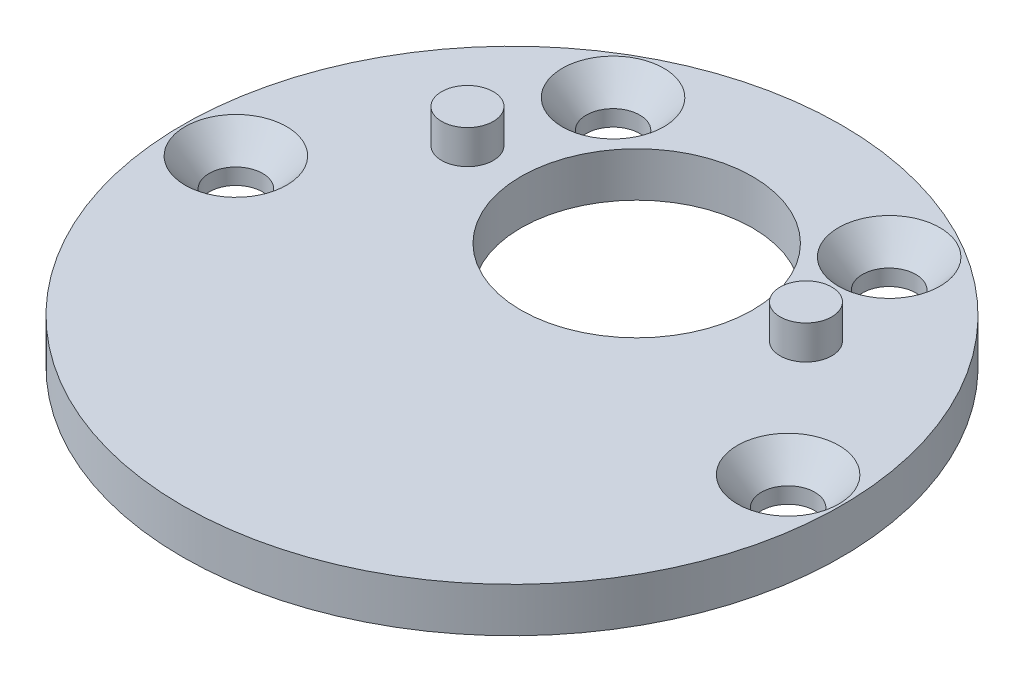
from build123d import *

# Parameters (mm, degrees)
SKETCH1_R                = 18.5
SKETCH1_R_2              = 1.5
BOSS_EXTRUDE1_DEPTH      = 2.5
BOSS_EXTRUDE2_DEPTH      = 1.9
BOSS_EXTRUDE2_DEPTH_BACK = 1
SKETCH2_R                = 1.45
SKETCH4_R                = 6.5
CUT_EXTRUDE1_DEPTH       = 27.282123202
CHAMFER1_SIZE            = 1.35
CHAMFER1_SIZE2           = 1.6


with BuildPart() as part:
    # Sketch1 → Boss-Extrude1 (new body)
    with BuildSketch(Plane(origin=(0, 0, 0), x_dir=(1, 0, 0), z_dir=(0, 1, 0))):
        Circle(SKETCH1_R)
        with Locations((-7.75, 13.423393759)):
            Circle(SKETCH1_R_2, mode=Mode.SUBTRACT)
        with Locations((-15.5, 0)):
            Circle(SKETCH1_R_2, mode=Mode.SUBTRACT)
        with Locations((7.75, 13.423393759)):
            Circle(SKETCH1_R_2, mode=Mode.SUBTRACT)
        with Locations((15.5, 0)):
            Circle(SKETCH1_R_2, mode=Mode.SUBTRACT)
    extrude(amount=BOSS_EXTRUDE1_DEPTH)

    # Sketch2 → Boss-Extrude2 (add, two sides: drawn at the far end of the back side and taken through both)
    with BuildSketch(Plane(origin=(0, 2.5, 0), x_dir=(1, 0, 0), z_dir=(0, 1, 0)).offset(-BOSS_EXTRUDE2_DEPTH_BACK)):
        with Locations((-9.5, 7)):
            Circle(SKETCH2_R)
        with Locations((9.5, 7)):
            Circle(SKETCH2_R)
    extrude(amount=BOSS_EXTRUDE2_DEPTH + BOSS_EXTRUDE2_DEPTH_BACK)

    # Sketch4 → Cut-Extrude1 (cut, through all)
    with BuildSketch(Plane(origin=(0, 2.5, 0), x_dir=(1, 0, 0), z_dir=(0, 1, 0))):
        with Locations((0, 7)):
            Circle(SKETCH4_R)
    extrude(amount=-CUT_EXTRUDE1_DEPTH, mode=Mode.SUBTRACT)

    # Chamfer1
    chamfer1_edges = [part.edges().sort_by_distance(p)[0] for p in [
        (-17, 2.5, 0),
        (14, 2.5, 0),
        (6.25, 2.5, -13.423393759),
        (-9.25, 2.5, -13.423393759),
    ]]
    chamfer1_side = [part.faces().sort_by_distance(p)[0] for p in [
        (0, 2.5, 1.344480454),
    ]]
    chamfer(chamfer1_edges, length=CHAMFER1_SIZE, length2=CHAMFER1_SIZE2, reference=chamfer1_side[0])


solid = part.part
